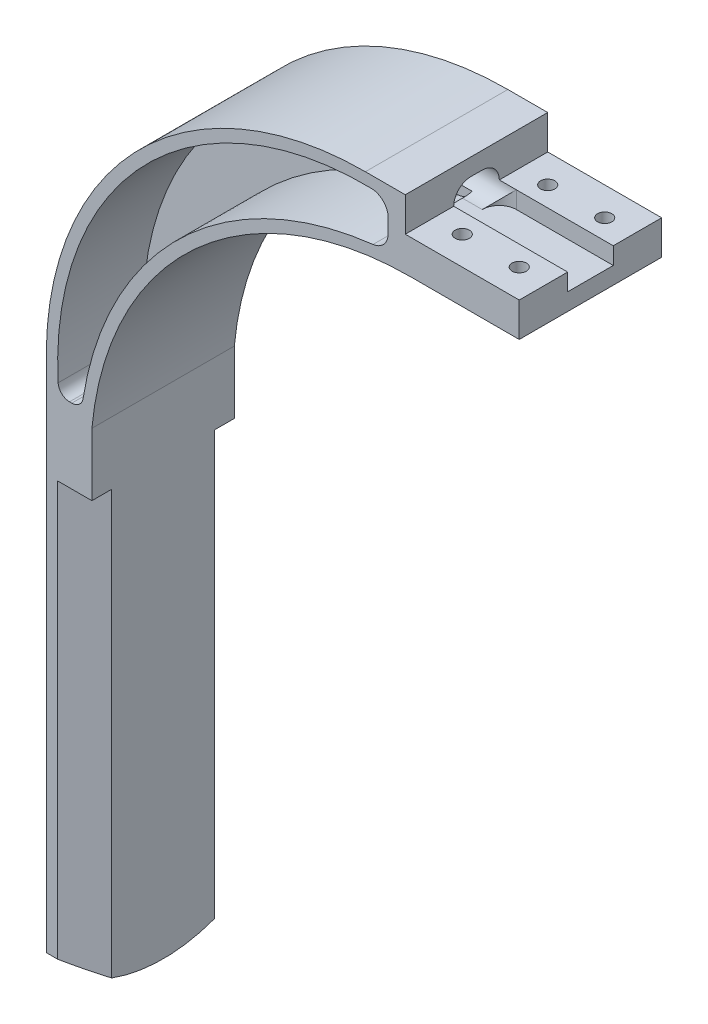
from build123d import *
from OCP.BRepAlgoAPI import BRepAlgoAPI_Cut
from OCP.TopTools import TopTools_ListOfShape

# Parameters (mm, degrees)
EXTRUDE_1_DEPTH      = 25
SKETCH_2_W           = 20
SKETCH_2_H           = 6
CUT_EXTRUDE_1_DEPTH  = 174.245490562
CUT_EXTRUDE_2_DEPTH  = 76
CUT_EXTRUDE_4_DEPTH  = 5
CUT_EXTRUDE_3_REACH  = 175.245
FILLET_3_R           = 2
FILLET_4_R           = 3
CUT_EXTRUDE_6_DEPTH  = 75
M3X0_51_D            = 2.5
CUT_EXTRUDE_7_REACH  = 175.245
SKETCH_13_W          = 20
SKETCH_13_H          = 8
CUT_EXTRUDE_8_DEPTH  = 3
FILLET_8_R           = 3
CUT_EXTRUDE_9_DEPTH  = 28
CUT_EXTRUDE_10_DEPTH = 6
EXTRUDE_2_DEPTH      = 5
M3X0_52_D            = 2.5
M3X0_52_DEPTH        = 4
M3X0_52_TIP          = 0.751075774


with BuildPart() as part:
    # Эскиз1 → Бобышка-Вытянуть1 (new body)
    with BuildSketch(Plane.XY):
        with BuildLine():
            Line((0, 0), (0, 95))
            ThreePointArc((0, 95), (16.753981094, 133.950491977), (56, 150))
            Line((56, 150), (83, 150))
            Line((83, 150), (83, 138))
            Line((83, 138), (64, 138))
            ThreePointArc((64, 138), (26.128506763, 123.339286692), (8, 87))
            Line((8, 87), (8, 0))
            Line((8, 0), (0, 0))
        make_face()
    extrude(amount=EXTRUDE_1_DEPTH)

    # Эскиз2 → Вырез-Вытянуть1 (cut, through all)
    with BuildSketch(Plane.XY.offset(25)):
        with Locations((73, 147)):
            Rectangle(SKETCH_2_W, SKETCH_2_H)
    extrude(amount=-CUT_EXTRUDE_1_DEPTH, mode=Mode.SUBTRACT)

    # Эскиз5 → Вырез-Вытянуть2 (cut)
    with BuildSketch(Plane.XZ):
        Polygon((8, 3.464101615), (2, 0), (8, 0), align=None)
        Polygon((8, 25), (8, 21.535898385), (2, 25), align=None)
    extrude(amount=-CUT_EXTRUDE_2_DEPTH, mode=Mode.SUBTRACT)

    # Эскиз6 → Вырез-Вытянуть4 (cut)
    with BuildSketch(Plane.ZY):
        with BuildLine():
            Line((10, -11.91606518), (10, 92.5))
            ThreePointArc((10, 92.5), (12.5, 95), (15, 92.5))
            Line((15, 92.5), (15, -11.91606518))
            ThreePointArc((15, -11.91606518), (12.5, -14.41606518), (10, -11.91606518))
        make_face()
    extrude(amount=-CUT_EXTRUDE_4_DEPTH, mode=Mode.SUBTRACT)

    # Вырез-Вытянуть3: up to this face of the body (flat: up to its plane)
    cut_extrude_3_end = Plane(part.part.faces().sort_by_distance((2.5, 46.25, 10))[0])
    # Эскиз3 → Вырез-Вытянуть3 (cut, up to the picked face)
    with BuildSketch(Plane(origin=(0, 0, 25), x_dir=(-1, 0, 0), z_dir=(0, 0, -1)), mode=Mode.PRIVATE) as cut_extrude_3_sk1:
        with BuildLine():
            Line((-60, 147.851673111), (-60, 139.862487056))
            ThreePointArc((-60, 139.862487056), (-24.008081752, 124.100361226), (-6.215777406, 89.067566648))
            Line((-6.215777406, 89.067566648), (-2.215777406, 89.067566648))
            ThreePointArc((-2.215777406, 89.067566648), (-17.483639866, 131.852128074), (-60, 147.851673111))
        make_face()
    cut_extrude_3_tool1 = split(extrude(cut_extrude_3_sk1.sketch, amount=CUT_EXTRUDE_3_REACH, mode=Mode.PRIVATE), bisect_by=cut_extrude_3_end, keep=Keep.BOTH, mode=Mode.PRIVATE)
    add(cut_extrude_3_tool1.solids().sort_by(Axis((26.403402, 126.933471, 25), (0, 0, -1)))[0], mode=Mode.SUBTRACT)

    # Скругление3
    fillet_3_edges = [part.edges().sort_by_distance(p)[0] for p in [
        (6.215777406, 89.067566648, 17.5),
        (2.215777406, 89.067566648, 20),
    ]]
    fillet(fillet_3_edges, radius=FILLET_3_R)

    # Скругление4
    fillet_4_edges = [part.edges().sort_by_distance(p)[0] for p in [
        (60, 139.862487056, 17.5),
        (60, 147.851673111, 17.5),
    ]]
    fillet(fillet_4_edges, radius=FILLET_4_R)

    # Эскиз8 → Вырез-Вытянуть6 (cut)
    with BuildSketch(Plane(origin=(0, 10, 0), x_dir=(1, 0, 0), z_dir=(0, 1, 0))):
        Polygon((0, -2), (1.5, -2), (1.5, -3), (3.5, -3), (3.5, -4), (5.5, -4), (5.5, -8), (0, -8), align=None)
        Polygon((3.5, -22), (3.5, -21), (5.5, -21), (5.5, -17), (0, -17), (0, -23), (1.5, -23), (1.5, -22), align=None)
    extrude(amount=CUT_EXTRUDE_6_DEPTH, mode=Mode.SUBTRACT)

    # Отверстие обработанное метчиком M3x0.51 (through all)
    with Locations(Plane(origin=(19.191951444, 144, 18.799685968), x_dir=(1, 0, 0), z_dir=(0, 1, 0))):
        with Locations((48.808048556, 13.799685968), (58.808048556, 13.799685968), (58.808048556, -1.200314032), (48.808048556, -1.200314032)):
            Hole(M3X0_51_D / 2)

    # Эскиз12 → Вырез-Вытянуть7 (cut, up to next)
    with BuildSketch(Plane.ZY, mode=Mode.PRIVATE) as cut_extrude_7_sk1:
        with BuildLine():
            Line((0, 3.30197377), (0, 0))
            Line((0, 0), (12.5, 0))
            Line((12.5, 0), (25, 0))
            Line((25, 0), (25, 3.30197377))
            ThreePointArc((25, 3.30197377), (12.5, 0.1), (0, 3.30197377))
        make_face()
    cut_extrude_7_tool1 = extrude(cut_extrude_7_sk1.sketch, amount=-CUT_EXTRUDE_7_REACH, mode=Mode.PRIVATE) & part.part
    add(cut_extrude_7_tool1.solids().sort_by_distance((0, 1.650987, 0.252171))[0], mode=Mode.SUBTRACT)

    # Эскиз13 → Вырез-Вытянуть8 (cut)
    with BuildSketch(Plane(origin=(0, 144, 0), x_dir=(1, 0, 0), z_dir=(0, 1, 0))):
        with Locations((73, -12.5)):
            Rectangle(SKETCH_13_W, SKETCH_13_H)
    extrude(amount=-CUT_EXTRUDE_8_DEPTH, mode=Mode.SUBTRACT)

    # Скругление8
    fillet_8_edges = [part.edges().sort_by_distance(p)[0] for p in [
        (63, 142.5, 16.5),
        (63, 142.5, 8.5),
    ]]
    fillet(fillet_8_edges, radius=FILLET_8_R)


with BuildPart() as cut_extrude_9_tool:
    # Эскиз14 → Вырез-Вытянуть9 (new body)
    with BuildSketch(Plane(origin=(83, 0, 0), x_dir=(0, 0, -1), z_dir=(1, 0, 0))):
        with BuildLine():
            Line((-13.5, 147), (-11.5, 147))
            ThreePointArc((-11.5, 147), (-8.5, 144), (-11.5, 141))
            Line((-11.5, 141), (-13.5, 141))
            ThreePointArc((-13.5, 141), (-16.5, 144), (-13.5, 147))
        make_face()
    extrude(amount=-CUT_EXTRUDE_9_DEPTH)


with BuildPart() as part_1:
    add(part.part)

    # Вырез-Вытянуть9: cut by cut_extrude_9_tool, with a tolerance
    cut_extrude_9_stock = TopTools_ListOfShape()
    cut_extrude_9_stock.Append(part_1.part.wrapped)
    cut_extrude_9_tools = TopTools_ListOfShape()
    cut_extrude_9_tools.Append(cut_extrude_9_tool.part.wrapped)
    cut_extrude_9_cut = BRepAlgoAPI_Cut()
    cut_extrude_9_cut.SetArguments(cut_extrude_9_stock)
    cut_extrude_9_cut.SetTools(cut_extrude_9_tools)
    cut_extrude_9_cut.SetFuzzyValue(0.00001)
    cut_extrude_9_cut.Build()
    add(Compound.cast(cut_extrude_9_cut.Shape()).solids(), mode=Mode.REPLACE)

    # Эскиз15 → Вырез-Вытянуть10 (cut)
    with BuildSketch(Plane.ZY):
        with BuildLine():
            Line((15, 92.5), (15, 85.5))
            ThreePointArc((15, 85.5), (12.5, 83), (10, 85.5))
            Line((10, 85.5), (10, 92.5))
            ThreePointArc((10, 92.5), (12.5, 95), (15, 92.5))
        make_face()
    extrude(amount=-CUT_EXTRUDE_10_DEPTH, mode=Mode.SUBTRACT)

    # Эскиз19 → Бобышка-Вытянуть2 (add)
    with BuildSketch(Plane.ZY):
        with BuildLine():
            Line((10, 10.1), (10, 0.220471411))
            ThreePointArc((10, 0.220471411), (12.5, 0.1), (15, 0.220471411))
            Line((15, 0.220471411), (15, 10.1))
            Line((15, 10.1), (10, 10.1))
        make_face()
    extrude(amount=-EXTRUDE_2_DEPTH)

    # Отверстие обработанное метчиком M3x0.52
    with Locations(Plane.ZY):
        with Locations((12.5, 5.1)):
            Hole(M3X0_52_D / 2, depth=M3X0_52_DEPTH)
            with Locations((0, 0, -(M3X0_52_DEPTH + M3X0_52_TIP / 2))):  # 118° drill point
                Cone(0, M3X0_52_D / 2, M3X0_52_TIP, mode=Mode.SUBTRACT)


solid = part_1.part
